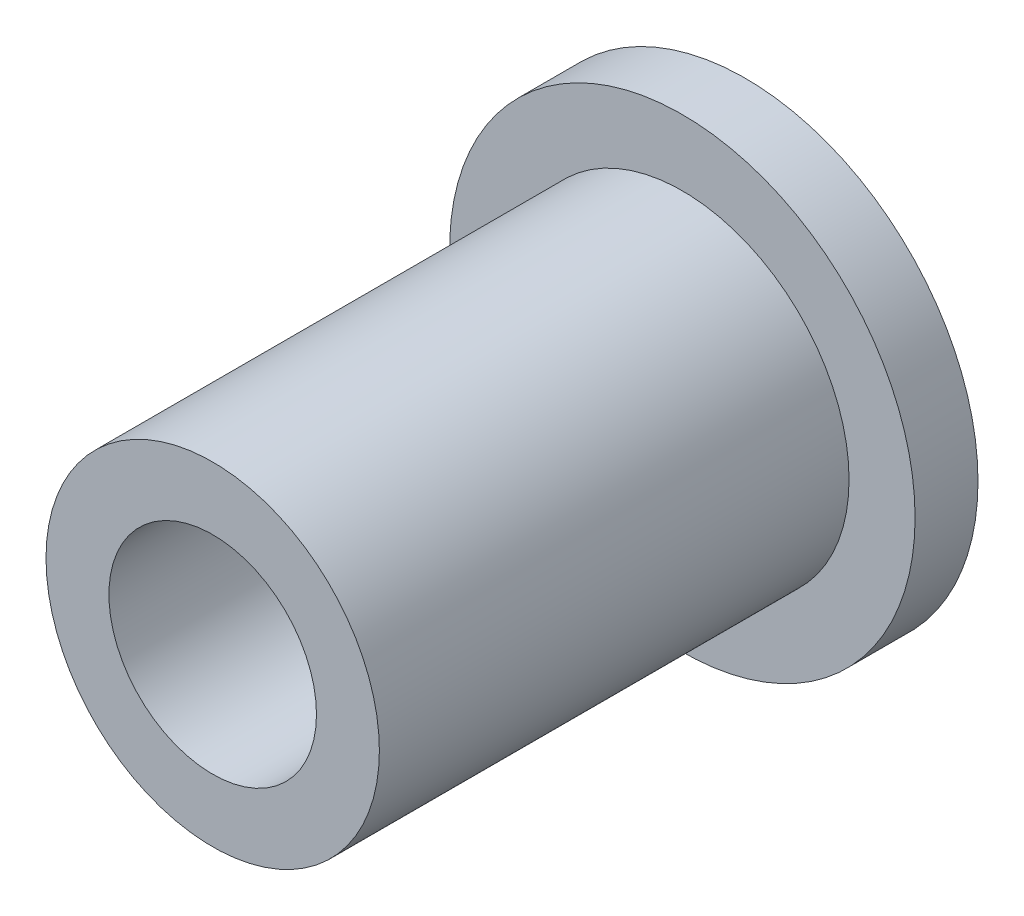
from build123d import *

# Parameters (mm, degrees)
SKETCH1_R           = 5.55
BASE_FLANGE1_DEPTH  = 1.5
SKETCH9_R           = 3.975
SKETCH9_R_2         = 2.475
BOSS_EXTRUDE1_DEPTH = 11.2
SKETCH11_R          = 2.475
CUT_EXTRUDE1_DEPTH  = 14.676439595


# Sheet-metal steps are written as plain solids
with BuildPart() as part:
    # Sketch1 → Base-Flange1 (new body)
    with BuildSketch(Plane.XY):
        Circle(SKETCH1_R)
    extrude(amount=-BASE_FLANGE1_DEPTH)

    # Sketch9 → Boss-Extrude1 (add)
    with BuildSketch(Plane.XY):
        Circle(SKETCH9_R)
        Circle(SKETCH9_R_2, mode=Mode.SUBTRACT)
    extrude(amount=BOSS_EXTRUDE1_DEPTH)

    # Sketch11 → Cut-Extrude1 (cut, through all)
    with BuildSketch(Plane.XY):
        Circle(SKETCH11_R)
    extrude(amount=-CUT_EXTRUDE1_DEPTH, mode=Mode.SUBTRACT)


solid = part.part
